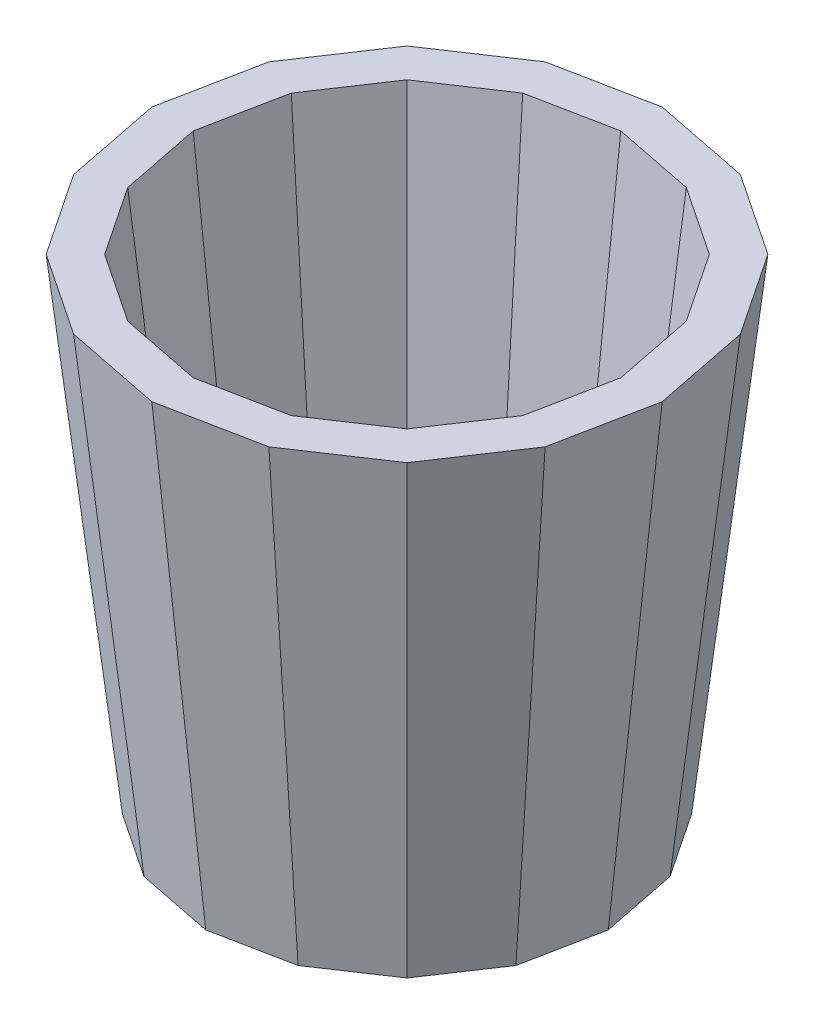
from build123d import *

# Parameters (mm, degrees)
SHELL1_T            = -19.05
SKETCH3_W           = 38.1
SKETCH3_H           = 76.2
BOSS_EXTRUDE1_DEPTH = 35.56
CIRPATTERN1_COUNT   = 16
SKETCH9_R           = 146.577055422
CUT_EXTRUDE2_DEPTH  = 372.536652975


with BuildPart() as part:
    # Sketch1 → Loft1 section 0
    with BuildSketch(Plane(origin=(0, 0, 0), x_dir=(1, 0, 0), z_dir=(0, 1, 0))):
        with BuildLine():
            Line((120.431396889, 0), (111.264102658, 46.087100326))
            Line((111.264102658, 46.087100326), (85.157857408, 85.157857408))
            Line((85.157857408, 85.157857408), (46.087100326, 111.264102658))
            Line((46.087100326, 111.264102658), (0, 120.431396889))
            Line((0, 120.431396889), (-46.087100326, 111.264102658))
            Line((-46.087100326, 111.264102658), (-85.157857408, 85.157857408))
            Line((-85.157857408, 85.157857408), (-111.264102658, 46.087100326))
            Line((-111.264102658, 46.087100326), (-120.431396889, 0))
            Line((-120.431396889, 0), (-111.264102658, -46.087100326))
            Line((-111.264102658, -46.087100326), (-85.157857408, -85.157857408))
            Line((-85.157857408, -85.157857408), (-46.087100326, -111.264102658))
            Line((-46.087100326, -111.264102658), (0, -120.431396889))
            Line((0, -120.431396889), (46.087100326, -111.264102658))
            Line((46.087100326, -111.264102658), (85.157857408, -85.157857408))
            Line((85.157857408, -85.157857408), (111.264102658, -46.087100326))
            Line((111.264102658, -46.087100326), (120.431396889, 0))
        make_face()
    # Sketch2 → Loft1 section 1
    with BuildSketch(Plane(origin=(0, -558.8, 0), x_dir=(1, 0, 0), z_dir=(0, 1, 0))):
        with BuildLine():
            Line((58.269634692, 0), (53.834122858, 22.298823806))
            Line((53.834122858, 22.298823806), (41.202853828, 41.202853828))
            Line((41.202853828, 41.202853828), (22.298823806, 53.834122858))
            Line((22.298823806, 53.834122858), (0, 58.269634692))
            Line((0, 58.269634692), (-22.298823806, 53.834122858))
            Line((-22.298823806, 53.834122858), (-41.202853828, 41.202853828))
            Line((-41.202853828, 41.202853828), (-53.834122858, 22.298823806))
            Line((-53.834122858, 22.298823806), (-58.269634692, 0))
            Line((-58.269634692, 0), (-53.834122858, -22.298823806))
            Line((-53.834122858, -22.298823806), (-41.202853828, -41.202853828))
            Line((-41.202853828, -41.202853828), (-22.298823806, -53.834122858))
            Line((-22.298823806, -53.834122858), (0, -58.269634692))
            Line((0, -58.269634692), (22.298823806, -53.834122858))
            Line((22.298823806, -53.834122858), (41.202853828, -41.202853828))
            Line((41.202853828, -41.202853828), (53.834122858, -22.298823806))
            Line((53.834122858, -22.298823806), (58.269634692, 0))
        make_face()
    loft()

    # Shell1
    shell1_openings = [part.faces().sort_by_distance(p)[0] for p in [
        (0, -558.8, 0),
        (0, 0, 0),
    ]]
    offset(amount=SHELL1_T, openings=shell1_openings, kind=Kind.INTERSECTION)

    # Sketch3 → Boss-Extrude1 (add)
    with BuildSketch(Plane.XY):
        with Locations((-54.643476483, -190.5)):
            Rectangle(SKETCH3_W, SKETCH3_H)
    boss_extrude1 = extrude(amount=-BOSS_EXTRUDE1_DEPTH)

    # CirPattern1: Boss-Extrude1 ×16 about axis
    cirpattern1_axis = Axis((0, -558.8, 0), (0, 1, 0))
    for i in range(1, CIRPATTERN1_COUNT):
        add(boss_extrude1.rotate(cirpattern1_axis, i * 360 / CIRPATTERN1_COUNT))

    # Sketch6 → Cut-Revolve1 (revolve, cut)
    with BuildSketch(Plane.XY):
        with BuildLine():
            Line((-81.11418083, -152.4), (-14.743300691, -152.4))
            Line((-14.743300691, -152.4), (-14.743300691, -228.6))
            Line((-14.743300691, -228.6), (-36.355532659, -228.6))
            add(Edge.make_bspline(
                [(-81.11418083, -152.4), (-79.607856994, -169.701169553), (-76.386585713, -209.289520828), (-64.307343509, -217.631175272), (-48.449104702, -222.476571571), (-35.486891181, -222.677165223), (-36.355532659, -228.6)],
                knots=[0, 0, 0, 0, 0.382975597, 0.562427745, 0.835112127, 1, 1, 1, 1], degree=3))
        make_face()
    revolve(axis=Axis((0, -222.066544959, 0), (0, 1, 0)), mode=Mode.SUBTRACT)

    # Sketch9 → Cut-Extrude2 (cut, through all)
    with BuildSketch(Plane(origin=(0, -228.6, 0), x_dir=(1, 0, 0), z_dir=(0, 1, 0))):
        Circle(SKETCH9_R)
    extrude(amount=-CUT_EXTRUDE2_DEPTH, mode=Mode.SUBTRACT)

    # Sketch10 → Cut-Revolve2 (revolve, cut)
    with BuildSketch(Plane.XY):
        with BuildLine():
            Line((-54.953221209, -219.976382318), (-32.39314642, -219.976382318))
            Line((-32.39314642, -219.976382318), (-32.39314642, -238.309056157))
            Line((-32.39314642, -238.309056157), (-49.264940505, -238.309056157))
            add(Edge.make_bspline(
                [(-54.953221209, -219.976382318), (-51.256325848, -221.208680772), (-43.716944673, -222.932450452), (-47.672246773, -236.12390882), (-49.264940505, -238.309056157)],
                knots=[0, 0, 0, 0, 0.374091672, 1, 1, 1, 1], degree=3))
        make_face()
    revolve(axis=Axis((0, 0, 0), (0, -1, 0)), mode=Mode.SUBTRACT)


solid = part.part
